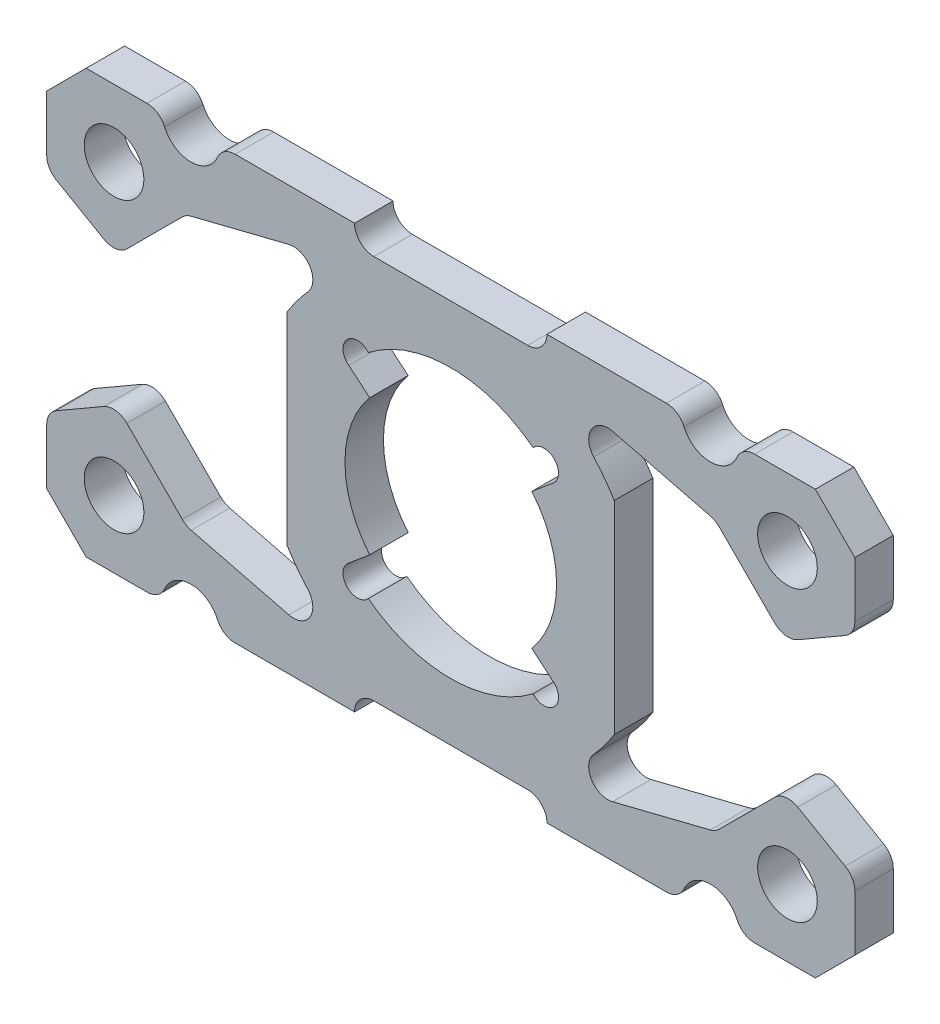
from build123d import *

# Parameters (mm, degrees)
SKETCH_1_R             = 1.55
SKETCH_1_R_2           = 7
EXTRUDE_1_DEPTH        = 1
CUT_EXTRUDE_1_DEPTH    = 24.790754507
FILLET_1_R             = 1
SKETCH_3_R             = 1.5
CUT_EXTRUDE_2_DEPTH    = 24.790754507
FILLET_2_R             = 1
FILLET_1_OF_MIRROR_1_R = 1
FILLET_2_OF_MIRROR_1_R = 1
CUT_EXTRUDE_3_DEPTH    = 24.790754507
FILLET_3_R             = 1
EXTRUDE_START          = -2
EXTRUDE_2_DEPTH        = 2
SKETCH_6_R             = 0.75
CUT_EXTRUDE_4_DEPTH    = 24.790754507
CUT_EXTRUDE_5_DEPTH    = 24.790754507
CUT_EXTRUDE_6_DEPTH    = 24.790754507
FILLET_4_R             = 1


with BuildPart() as part:
    # 草图1 → 凸台-拉伸1 (new, symmetric)
    with BuildSketch(Plane.XY):
        Polygon((-21, 8.949747468), (-21, -8.949747468), (-18.949747468, -11), (18.949747468, -11), (21, -8.949747468), (21, 8.949747468), (18.949747468, 11), (-18.949747468, 11), align=None)
        with Locations((-17.5, 7.5)):
            Circle(SKETCH_1_R, mode=Mode.SUBTRACT)
        with Locations((-17.5, -7.5)):
            Circle(SKETCH_1_R, mode=Mode.SUBTRACT)
        with Locations((17.5, -7.5)):
            Circle(SKETCH_1_R, mode=Mode.SUBTRACT)
        with Locations((17.5, 7.5)):
            Circle(SKETCH_1_R, mode=Mode.SUBTRACT)
        Circle(SKETCH_1_R_2, mode=Mode.SUBTRACT)
    extrude(amount=EXTRUDE_1_DEPTH, both=True)

    # 草图2 → 切除-拉伸1 (cut, through all)
    with BuildSketch(Plane.XY.offset(1)):
        Polygon((-21, 5.479274058), (-19.5, 4.613248654), (-19.5, -4.613248654), (-21, -5.479274058), align=None)
        with BuildLine():
            Line((-17, 3.757359313), (-17, -3.757359313))
            Line((-17, -3.757359313), (-13.757359313, -7))
            Line((-13.757359313, -7), (-7.757359313, -8.5))
            Line((-7.757359313, -8.5), (-5.267826876, -8.5))
            ThreePointArc((-5.267826876, -8.5), (-10, 0), (-5.267826876, 8.5))
            Line((-5.267826876, 8.5), (-7.757359313, 8.5))
            Line((-7.757359313, 8.5), (-13.757359313, 7))
            Line((-13.757359313, 7), (-17, 3.757359313))
        make_face()
    cut_extrude_1 = extrude(amount=-CUT_EXTRUDE_1_DEPTH, mode=Mode.SUBTRACT)

    # 圆角1
    # the kernel refuses this fillet: 1 mm, written as the material it adds along each edge
    with BuildSketch(Plane(origin=(-19.5, 4.613248654, 1), x_dir=(-0.8660254037844358, 0.5000000000000049, 0), z_dir=(0, 0, -1))) as fillet_1_piece_1:
        with BuildLine():
            CenterArc((FILLET_1_R * 0.57735026919, -FILLET_1_R), FILLET_1_R, 90, 60)
            Line((-FILLET_1_R * 0.288675134595, -FILLET_1_R * 0.5), (-FILLET_1_R * 0.30599564267, -FILLET_1_R * 0.49))
            Line((-FILLET_1_R * 0.30599564267, -FILLET_1_R * 0.49), (-FILLET_1_R * 0.0115470053838, FILLET_1_R * 0.02))
            Line((-FILLET_1_R * 0.0115470053838, FILLET_1_R * 0.02), (FILLET_1_R * 0.57735026919, FILLET_1_R * 0.02))
            Line((FILLET_1_R * 0.57735026919, FILLET_1_R * 0.02), (FILLET_1_R * 0.57735026919, 0))
        make_face()
    extrude(amount=2)
    with BuildSketch(Plane(origin=(-19.5, -4.613248654, 1), x_dir=(-0.8660254037844358, -0.5000000000000049, 0), z_dir=(0, 0, -1))) as fillet_1_piece_2:
        with BuildLine():
            CenterArc((FILLET_1_R * 0.57735026919, FILLET_1_R), FILLET_1_R, 210, 60)
            Line((-FILLET_1_R * 0.288675134595, FILLET_1_R * 0.5), (-FILLET_1_R * 0.30599564267, FILLET_1_R * 0.49))
            Line((-FILLET_1_R * 0.30599564267, FILLET_1_R * 0.49), (-FILLET_1_R * 0.0115470053838, -FILLET_1_R * 0.02))
            Line((-FILLET_1_R * 0.0115470053838, -FILLET_1_R * 0.02), (FILLET_1_R * 0.57735026919, -FILLET_1_R * 0.02))
            Line((FILLET_1_R * 0.57735026919, -FILLET_1_R * 0.02), (FILLET_1_R * 0.57735026919, 0))
        make_face()
    extrude(amount=2)
    with BuildSketch(Plane(origin=(-5.267826876, -8.5, 1), x_dir=(-1, 0, 0), z_dir=(0, 0, -1))) as fillet_1_piece_3:
        with BuildLine():
            CenterArc((2.747285214, 0.966210901), FILLET_1_R, 136.773049556, 118.290188871)
            Line((2.01863866, 1.651100819), (2.004065729, 1.664798618))
            ThreePointArc((2.004065729, 1.664798618), (1.050711081, 0.774944785), (-0.010535654, 0.017))
            Line((-0.010535654, 0.017), (0, -0.02))
            ThreePointArc((0, -0.02), (1.244766218, -0.02), (2.484377381, -0.019324218))
            Line((2.484377381, -0.019324218), (2.489532436, 0))
        make_face()
    extrude(amount=2)
    with BuildSketch(Plane(origin=(-13.757359313, -7, 1), x_dir=(-0.7071067811865476, 0.7071067811865476, 0), z_dir=(0, 0, -1)), Plane(origin=(-13.757359313, 7, 1), x_dir=(0.9701425001453319, 0.24253562503633297, 0), z_dir=(0, 0, -1))) as fillet_1_piece_4:
        with BuildLine():
            CenterArc((FILLET_1_R * 0.276983964948, FILLET_1_R), FILLET_1_R, 239.036243468, 30.963756532)
            Line((-FILLET_1_R * 0.237511790479, FILLET_1_R * 0.142507074287), (-FILLET_1_R * 0.247801705588, FILLET_1_R * 0.125357215773))
            Line((-FILLET_1_R * 0.247801705588, FILLET_1_R * 0.125357215773), (-FILLET_1_R * 0.00553967929897, -FILLET_1_R * 0.02))
            Line((-FILLET_1_R * 0.00553967929897, -FILLET_1_R * 0.02), (FILLET_1_R * 0.276983964948, -FILLET_1_R * 0.02))
            Line((FILLET_1_R * 0.276983964948, -FILLET_1_R * 0.02), (FILLET_1_R * 0.276983964948, 0))
        make_face()
    extrude(amount=2)
    with BuildSketch(Plane(origin=(-17, -3.757359313, 1), x_dir=(0, 1, 0), z_dir=(0, 0, -1))) as fillet_1_piece_5:
        with BuildLine():
            CenterArc((FILLET_1_R * 0.414213562373, FILLET_1_R), FILLET_1_R, 225, 45)
            Line((-FILLET_1_R * 0.292893218813, FILLET_1_R * 0.292893218813), (-FILLET_1_R * 0.307035354437, FILLET_1_R * 0.27875108319))
            Line((-FILLET_1_R * 0.307035354437, FILLET_1_R * 0.27875108319), (-FILLET_1_R * 0.00828427124746, -FILLET_1_R * 0.02))
            Line((-FILLET_1_R * 0.00828427124746, -FILLET_1_R * 0.02), (FILLET_1_R * 0.414213562373, -FILLET_1_R * 0.02))
            Line((FILLET_1_R * 0.414213562373, -FILLET_1_R * 0.02), (FILLET_1_R * 0.414213562373, 0))
        make_face()
    extrude(amount=2)
    with BuildSketch(Plane(origin=(-17, 3.757359313, 1), x_dir=(0, -1, 0), z_dir=(0, 0, -1))) as fillet_1_piece_6:
        with BuildLine():
            CenterArc((FILLET_1_R * 0.414213562373, -FILLET_1_R), FILLET_1_R, 90, 45)
            Line((-FILLET_1_R * 0.292893218813, -FILLET_1_R * 0.292893218813), (-FILLET_1_R * 0.307035354437, -FILLET_1_R * 0.27875108319))
            Line((-FILLET_1_R * 0.307035354437, -FILLET_1_R * 0.27875108319), (-FILLET_1_R * 0.00828427124746, FILLET_1_R * 0.02))
            Line((-FILLET_1_R * 0.00828427124746, FILLET_1_R * 0.02), (FILLET_1_R * 0.414213562373, FILLET_1_R * 0.02))
            Line((FILLET_1_R * 0.414213562373, FILLET_1_R * 0.02), (FILLET_1_R * 0.414213562373, 0))
        make_face()
    extrude(amount=2)
    with BuildSketch(Plane(origin=(-5.267826876, 8.5, 1), x_dir=(-0.7740536287886277, -0.6331200358219264, 0), z_dir=(0, 0, -1))) as fillet_1_piece_7:
        with BuildLine():
            CenterArc((2.738273569, 0.991462259), FILLET_1_R, 144.217451659, 118.290188871)
            Line((1.927031616, 1.576172865), (1.910806777, 1.587867077))
            ThreePointArc((1.910806777, 1.587867077), (0.950853407, 0.803567505), (-0.012662401, 0.015481073))
            Line((-0.012662401, 0.015481073), (0.00260788, -0.019829245))
            ThreePointArc((0.00260788, -0.019829245), (1.303939795, 0.065377415), (2.60527171, -0.019829245))
            Line((2.60527171, -0.019829245), (2.60787959, 0))
        make_face()
    extrude(amount=2)

    # 草图3 → 切除-拉伸2 (cut, through all)
    with BuildSketch(Plane.XY.offset(1)):
        with Locations((-13.5, 11)):
            Circle(SKETCH_3_R)
        with Locations((-13.5, -11)):
            Circle(SKETCH_3_R)
    cut_extrude_2 = extrude(amount=-CUT_EXTRUDE_2_DEPTH, mode=Mode.SUBTRACT)

    # 圆角2
    fillet_2_edges = [part.edges().sort_by_distance(p)[0] for p in [
        (-15, 11, 0),
        (-12, 11, 0),
        (-12, -11, 0),
        (-15, -11, 0),
    ]]
    fillet(fillet_2_edges, radius=FILLET_2_R)

    # 镜向1: 切除-拉伸1, 切除-拉伸2 across plane
    add(cut_extrude_1.mirror(Plane(origin=(0, 0, 0), x_dir=(0, 0, 1), z_dir=(1, 0, 0))), mode=Mode.SUBTRACT)
    add(cut_extrude_2.mirror(Plane(origin=(0, 0, 0), x_dir=(0, 0, 1), z_dir=(1, 0, 0))), mode=Mode.SUBTRACT)

    # 圆角1 of 镜向1
    # the kernel refuses this fillet: 1 mm, written as the material it adds along each edge
    with BuildSketch(Plane(origin=(19.5, 4.613248654, 1), x_dir=(0.866025403784436, 0.5000000000000044, 0), z_dir=(0, 0, -1)), Plane(origin=(19.5, -4.613248654, 1), x_dir=(0, 1, 0), z_dir=(0, 0, -1))) as fillet_1_of_mirror_1_piece_1:
        with BuildLine():
            CenterArc((FILLET_1_OF_MIRROR_1_R * 0.57735026919, FILLET_1_OF_MIRROR_1_R), FILLET_1_OF_MIRROR_1_R, 210, 60)
            Line((-FILLET_1_OF_MIRROR_1_R * 0.288675134595, FILLET_1_OF_MIRROR_1_R * 0.5), (-FILLET_1_OF_MIRROR_1_R * 0.305995642671, FILLET_1_OF_MIRROR_1_R * 0.49))
            Line((-FILLET_1_OF_MIRROR_1_R * 0.305995642671, FILLET_1_OF_MIRROR_1_R * 0.49), (-FILLET_1_OF_MIRROR_1_R * 0.0115470053838, -FILLET_1_OF_MIRROR_1_R * 0.02))
            Line((-FILLET_1_OF_MIRROR_1_R * 0.0115470053838, -FILLET_1_OF_MIRROR_1_R * 0.02), (FILLET_1_OF_MIRROR_1_R * 0.57735026919, -FILLET_1_OF_MIRROR_1_R * 0.02))
            Line((FILLET_1_OF_MIRROR_1_R * 0.57735026919, -FILLET_1_OF_MIRROR_1_R * 0.02), (FILLET_1_OF_MIRROR_1_R * 0.57735026919, 0))
        make_face()
    extrude(amount=2)
    with BuildSketch(Plane(origin=(5.267826876, -8.5, 1), x_dir=(0.7740536287886277, 0.6331200358219264, 0), z_dir=(0, 0, -1))) as fillet_1_of_mirror_1_piece_2:
        with BuildLine():
            CenterArc((2.738273569, 0.991462259), FILLET_1_OF_MIRROR_1_R, 144.217451659, 118.290188871)
            Line((1.927031616, 1.576172865), (1.910806777, 1.587867077))
            ThreePointArc((1.910806777, 1.587867077), (0.950853407, 0.803567505), (-0.012662401, 0.015481073))
            Line((-0.012662401, 0.015481073), (0.00260788, -0.019829245))
            ThreePointArc((0.00260788, -0.019829245), (1.303939795, 0.065377415), (2.60527171, -0.019829245))
            Line((2.60527171, -0.019829245), (2.60787959, 0))
        make_face()
    extrude(amount=2)
    with BuildSketch(Plane(origin=(13.757359313, -7, 1), x_dir=(0.7071067811865476, 0.7071067811865476, 0), z_dir=(0, 0, -1))) as fillet_1_of_mirror_1_piece_3:
        with BuildLine():
            CenterArc((FILLET_1_OF_MIRROR_1_R * 0.276983964948, -FILLET_1_OF_MIRROR_1_R), FILLET_1_OF_MIRROR_1_R, 90, 30.963756532)
            Line((-FILLET_1_OF_MIRROR_1_R * 0.237511790479, -FILLET_1_OF_MIRROR_1_R * 0.142507074287), (-FILLET_1_OF_MIRROR_1_R * 0.247801705588, -FILLET_1_OF_MIRROR_1_R * 0.125357215773))
            Line((-FILLET_1_OF_MIRROR_1_R * 0.247801705588, -FILLET_1_OF_MIRROR_1_R * 0.125357215773), (-FILLET_1_OF_MIRROR_1_R * 0.00553967929897, FILLET_1_OF_MIRROR_1_R * 0.02))
            Line((-FILLET_1_OF_MIRROR_1_R * 0.00553967929897, FILLET_1_OF_MIRROR_1_R * 0.02), (FILLET_1_OF_MIRROR_1_R * 0.276983964948, FILLET_1_OF_MIRROR_1_R * 0.02))
            Line((FILLET_1_OF_MIRROR_1_R * 0.276983964948, FILLET_1_OF_MIRROR_1_R * 0.02), (FILLET_1_OF_MIRROR_1_R * 0.276983964948, 0))
        make_face()
    extrude(amount=2)
    with BuildSketch(Plane(origin=(17, -3.757359313, 1), x_dir=(0, 1, 0), z_dir=(0, 0, -1)), Plane(origin=(17, 3.757359313, 1), x_dir=(-0.7071067811865465, 0.7071067811865486, 0), z_dir=(0, 0, -1))) as fillet_1_of_mirror_1_piece_4:
        with BuildLine():
            CenterArc((FILLET_1_OF_MIRROR_1_R * 0.414213562373, -FILLET_1_OF_MIRROR_1_R), FILLET_1_OF_MIRROR_1_R, 90, 45)
            Line((-FILLET_1_OF_MIRROR_1_R * 0.292893218813, -FILLET_1_OF_MIRROR_1_R * 0.292893218813), (-FILLET_1_OF_MIRROR_1_R * 0.307035354437, -FILLET_1_OF_MIRROR_1_R * 0.27875108319))
            Line((-FILLET_1_OF_MIRROR_1_R * 0.307035354437, -FILLET_1_OF_MIRROR_1_R * 0.27875108319), (-FILLET_1_OF_MIRROR_1_R * 0.00828427124746, FILLET_1_OF_MIRROR_1_R * 0.02))
            Line((-FILLET_1_OF_MIRROR_1_R * 0.00828427124746, FILLET_1_OF_MIRROR_1_R * 0.02), (FILLET_1_OF_MIRROR_1_R * 0.414213562373, FILLET_1_OF_MIRROR_1_R * 0.02))
            Line((FILLET_1_OF_MIRROR_1_R * 0.414213562373, FILLET_1_OF_MIRROR_1_R * 0.02), (FILLET_1_OF_MIRROR_1_R * 0.414213562373, 0))
        make_face()
    extrude(amount=2)
    with BuildSketch(Plane(origin=(13.757359313, 7, 1), x_dir=(0.7071067811865491, -0.7071067811865459, 0), z_dir=(0, 0, -1))) as fillet_1_of_mirror_1_piece_5:
        with BuildLine():
            CenterArc((FILLET_1_OF_MIRROR_1_R * 0.276983964948, FILLET_1_OF_MIRROR_1_R), FILLET_1_OF_MIRROR_1_R, 239.036243468, 30.963756532)
            Line((-FILLET_1_OF_MIRROR_1_R * 0.237511790479, FILLET_1_OF_MIRROR_1_R * 0.142507074287), (-FILLET_1_OF_MIRROR_1_R * 0.247801705588, FILLET_1_OF_MIRROR_1_R * 0.125357215773))
            Line((-FILLET_1_OF_MIRROR_1_R * 0.247801705588, FILLET_1_OF_MIRROR_1_R * 0.125357215773), (-FILLET_1_OF_MIRROR_1_R * 0.00553967929897, -FILLET_1_OF_MIRROR_1_R * 0.02))
            Line((-FILLET_1_OF_MIRROR_1_R * 0.00553967929897, -FILLET_1_OF_MIRROR_1_R * 0.02), (FILLET_1_OF_MIRROR_1_R * 0.276983964948, -FILLET_1_OF_MIRROR_1_R * 0.02))
            Line((FILLET_1_OF_MIRROR_1_R * 0.276983964948, -FILLET_1_OF_MIRROR_1_R * 0.02), (FILLET_1_OF_MIRROR_1_R * 0.276983964948, 0))
        make_face()
    extrude(amount=2)
    with BuildSketch(Plane(origin=(5.267826876, 8.5, 1), x_dir=(1, 0, 0), z_dir=(0, 0, -1))) as fillet_1_of_mirror_1_piece_6:
        with BuildLine():
            CenterArc((2.747285214, 0.966210901), FILLET_1_OF_MIRROR_1_R, 136.773049556, 118.290188871)
            Line((2.01863866, 1.651100819), (2.004065729, 1.664798618))
            ThreePointArc((2.004065729, 1.664798618), (1.050711081, 0.774944785), (-0.010535654, 0.017))
            Line((-0.010535654, 0.017), (0, -0.02))
            ThreePointArc((0, -0.02), (1.244766218, -0.02), (2.484377381, -0.019324218))
            Line((2.484377381, -0.019324218), (2.489532436, 0))
        make_face()
    extrude(amount=2)

    # 圆角2 of 镜向1
    fillet_2_of_mirror_1_edges = [part.edges().sort_by_distance(p)[0] for p in [
        (15, 11, 0),
        (12, 11, 0),
        (12, -11, 0),
        (15, -11, 0),
    ]]
    fillet(fillet_2_of_mirror_1_edges, radius=FILLET_2_OF_MIRROR_1_R)

    # 草图4 → 切除-拉伸3 (cut, through all)
    with BuildSketch(Plane.XY.offset(1)):
        with BuildLine():
            Line((-4, 12), (4, 12))
            ThreePointArc((4, 12), (5, 11), (4, 10))
            Line((4, 10), (-4, 10))
            ThreePointArc((-4, 10), (-5, 11), (-4, 12))
        make_face()
    cut_extrude_3 = extrude(amount=-CUT_EXTRUDE_3_DEPTH, mode=Mode.SUBTRACT)

    # 镜向2: 切除-拉伸3 across plane
    add(cut_extrude_3.mirror(Plane.ZX), mode=Mode.SUBTRACT)

    # 圆角3
    # the kernel refuses this fillet: 1 mm, written as the material it adds along each edge
    with BuildSketch(Plane(origin=(7.757359313, 8.5, 1), x_dir=(-0.18033615776387593, -0.9836050377071899, 0), z_dir=(0, 0, -1)), Plane(origin=(-7.757359313, -8.5, 1), x_dir=(0.18033615776387713, 0.9836050377071898, 0), z_dir=(0, 0, -1))) as fillet_3_piece_1:
        with BuildLine():
            CenterArc((1.040891337, -0.609732036), FILLET_3_R, 37.570129933, 146.076772884)
            Line((0.042916344, -0.673339527), (-0.056881155, -0.679700277))
            Line((-0.056881155, -0.679700277), (-0.099797499, -0.006360749))
            Line((-0.099797499, -0.006360749), (-0.090388776, 0.042776969))
            ThreePointArc((-0.090388776, 0.042776969), (1.789456507, 0.224739313), (1.912759723, 0.060973204))
            Line((1.912759723, 0.060973204), (1.833498961, 0))
        make_face()
    extrude(amount=2)
    with BuildSketch(Plane(origin=(7.757359313, -8.5, 1), x_dir=(-0.18033615776387926, 0.9836050377071893, 0), z_dir=(0, 0, -1))) as fillet_3_piece_2:
        with BuildLine():
            CenterArc((1.040891337, 0.609732036), FILLET_3_R, 176.353097183, 146.076772884)
            Line((0.042916344, 0.673339527), (-0.056881155, 0.679700277))
            Line((-0.056881155, 0.679700277), (-0.099797499, 0.006360749))
            Line((-0.099797499, 0.006360749), (-0.090388776, -0.042776969))
            ThreePointArc((-0.090388776, -0.042776969), (1.789456507, -0.224739313), (1.912759723, -0.060973204))
            Line((1.912759723, -0.060973204), (1.833498961, 0))
        make_face()
    extrude(amount=2)
    with BuildSketch(Plane(origin=(-7.757359313, 8.5, 1), x_dir=(-0.9701425001453321, -0.24253562503633236, 0), z_dir=(0, 0, -1))) as fillet_3_piece_3:
        with BuildLine():
            CenterArc((0.674705811, -1), FILLET_3_R, 90, 146.076772884)
            Line((0.11662427, -1.829786113), (0.060816116, -1.912764724))
            ThreePointArc((0.060816116, -1.912764724), (-0.110461375, -1.80012795), (-0.048439749, 0.087484803))
            Line((-0.048439749, 0.087484803), (0, 0.1))
            Line((0, 0.1), (0.674705811, 0.1))
            Line((0.674705811, 0.1), (0.674705811, 0))
        make_face()
    extrude(amount=2)

    # 草图5 → 凸台-拉伸2 (add)
    with BuildSketch(Plane.XY.offset(1).offset(EXTRUDE_START)):
        with BuildLine():
            Line((-5.362311102, 4.499513268), (-4.213244437, 3.535331853))
            ThreePointArc((-4.213244437, 3.535331853), (-5.5, 0), (-4.213244437, -3.535331853))
            Line((-4.213244437, -3.535331853), (-5.362311102, -4.499513268))
            ThreePointArc((-5.362311102, -4.499513268), (-7, 0), (-5.362311102, 4.499513268))
        make_face()
        with BuildLine():
            Line((4.213244437, 3.535331853), (5.362311102, 4.499513268))
            ThreePointArc((5.362311102, 4.499513268), (7, 0), (5.362311102, -4.499513268))
            Line((5.362311102, -4.499513268), (4.213244437, -3.535331853))
            ThreePointArc((4.213244437, -3.535331853), (5.5, 0), (4.213244437, 3.535331853))
        make_face()
    extrude(amount=EXTRUDE_2_DEPTH)

    # 草图6 → 切除-拉伸4 (cut, through all)
    with BuildSketch(Plane.XY.offset(1)):
        with Locations((-4.850134096, 5.047395294)):
            Circle(SKETCH_6_R)
        with Locations((-4.850134096, -5.047395294)):
            Circle(SKETCH_6_R)
    cut_extrude_4 = extrude(amount=-CUT_EXTRUDE_4_DEPTH, mode=Mode.SUBTRACT)

    # 镜向3: 切除-拉伸4 across plane
    add(cut_extrude_4.mirror(Plane(origin=(0, 0, 0), x_dir=(0, 0, 1), z_dir=(1, 0, 0))), mode=Mode.SUBTRACT)

    # 草图7 → 切除-拉伸5 (cut, through all)
    with BuildSketch(Plane.XY.offset(1)):
        with BuildLine():
            Line((-8.5, 5.267826876), (-8.5, -5.267826876))
            ThreePointArc((-8.5, -5.267826876), (-10, 0), (-8.5, 5.267826876))
        make_face()
        with BuildLine():
            Line((8.5, 5.267826876), (8.5, -5.267826876))
            ThreePointArc((8.5, -5.267826876), (10, 0), (8.5, 5.267826876))
        make_face()
    extrude(amount=-CUT_EXTRUDE_5_DEPTH, mode=Mode.SUBTRACT)

    # 草图8 → 切除-拉伸6 (cut, through all)
    with BuildSketch(Plane.XY.offset(1)):
        with BuildLine():
            Line((-20, 4.901923789), (-17.37245141, 3.384907903))
            Line((-17.37245141, 3.384907903), (-16.707106781, 4.050252532))
            ThreePointArc((-16.707106781, 4.050252532), (-16.923879533, 3.725829183), (-17, 3.343145751))
            Line((-17, 3.343145751), (-17, -3.343145751))
            ThreePointArc((-17, -3.343145751), (-16.923879533, -3.725829183), (-16.707106781, -4.050252532))
            Line((-16.707106781, -4.050252532), (-17.37245141, -3.384907903))
            Line((-17.37245141, -3.384907903), (-20, -4.901923789))
            ThreePointArc((-20, -4.901923789), (-19.633974596, -4.535898385), (-19.5, -4.035898385))
            Line((-19.5, -4.035898385), (-19.5, 4.035898385))
            ThreePointArc((-19.5, 4.035898385), (-19.633974596, 4.535898385), (-20, 4.901923789))
        make_face()
    cut_extrude_6 = extrude(amount=-CUT_EXTRUDE_6_DEPTH, mode=Mode.SUBTRACT)

    # 镜向4: 切除-拉伸6 across plane
    add(cut_extrude_6.mirror(Plane(origin=(0, 0, 0), x_dir=(0, 0, 1), z_dir=(1, 0, 0))), mode=Mode.SUBTRACT)

    # 圆角4
    fillet_4_edges = [part.edges().sort_by_distance(p)[0] for p in [
        (21, 5.479274058, 0),
        (21, -5.479274058, 0),
        (-17.37245141, -3.384907903, 0),
        (-17.37245141, 3.384907903, 0),
        (17.37245141, 3.384907903, 0),
        (17.37245141, -3.384907903, 0),
        (-21, -5.479274058, 0),
        (-21, 5.479274058, 0),
    ]]
    fillet(fillet_4_edges, radius=FILLET_4_R)


solid = part.part
